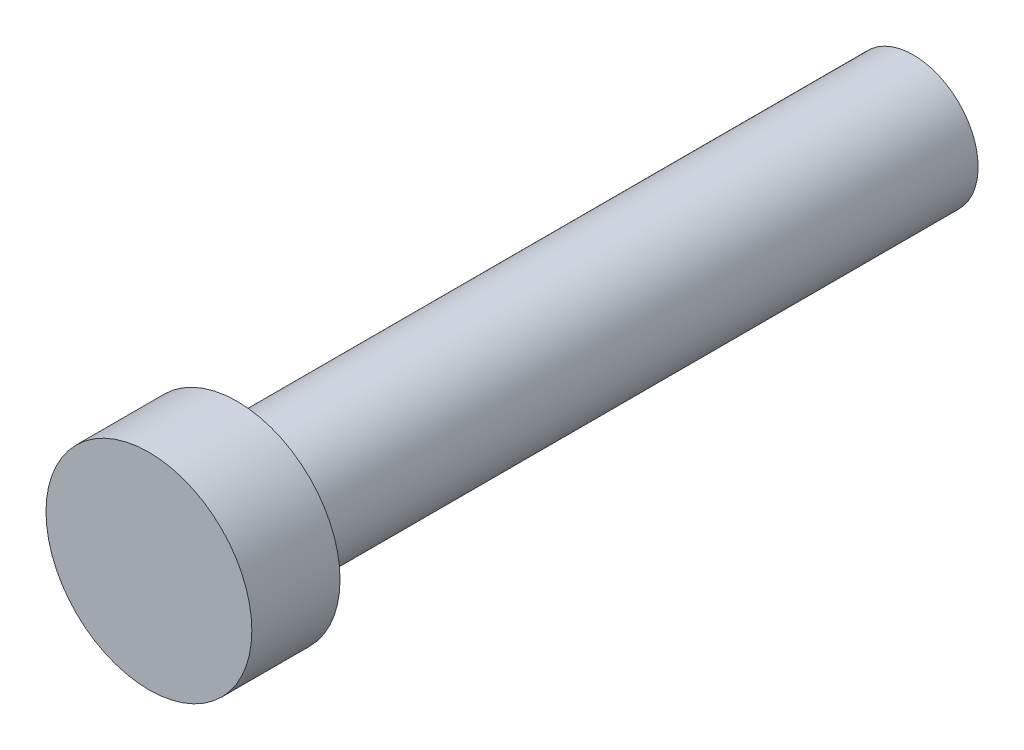
from build123d import *

# Parameters (mm, degrees)
SKETCH1_R           = 2.2
BOSS_EXTRUDE1_DEPTH = 26
SKETCH2_R           = 3.5
BOSS_EXTRUDE2_DEPTH = 3
SKETCH3_R           = 1
CUT_EXTRUDE1_DEPTH  = 5


with BuildPart() as part:
    # Sketch1 → Boss-Extrude1 (new body)
    with BuildSketch(Plane.XY):
        Circle(SKETCH1_R)
    extrude(amount=BOSS_EXTRUDE1_DEPTH)

    # Sketch2 → Boss-Extrude2 (add)
    with BuildSketch(Plane.XY.offset(26)):
        Circle(SKETCH2_R)
    extrude(amount=-BOSS_EXTRUDE2_DEPTH)

    # Sketch3 → Cut-Extrude1 (cut)
    with BuildSketch(Plane(origin=(0, 0, 0), x_dir=(-1, 0, 0), z_dir=(0, 0, -1))):
        Circle(SKETCH3_R)
    extrude(amount=-CUT_EXTRUDE1_DEPTH, mode=Mode.SUBTRACT)


solid = part.part
